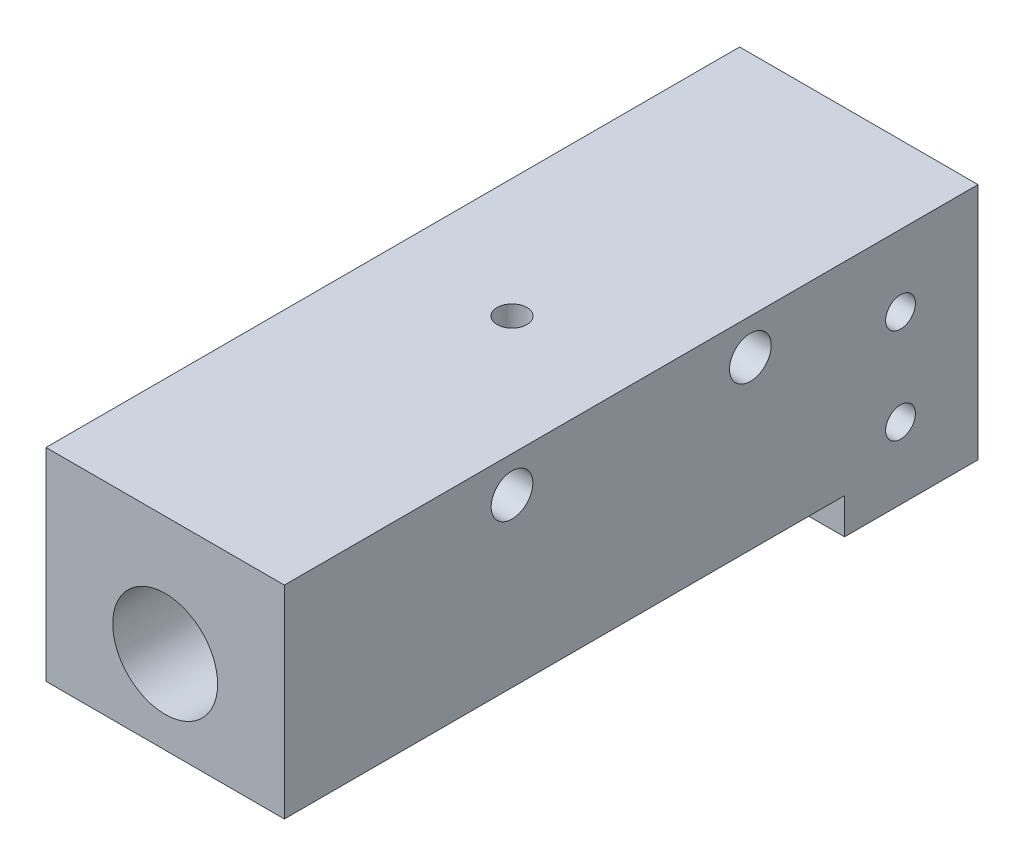
from build123d import *

# Parameters (mm, degrees)
SCHIZZO1_W                    = 20
SCHIZZO1_H                    = 20
ESTRUSIONE_ESTRUSIONE1_DEPTH  = 58.2
SCHIZZO2_R                    = 3
TAGLIO_ESTRUSIONE1_DEPTH      = 60.893572276
SCHIZZO3_R                    = 6
TAGLIO_ESTRUSIONE2_DEPTH      = 13
SCHIZZO4_R                    = 1.75
TAGLIO_ESTRUSIONE3_DEPTH      = 63.347734522
FORO_FILETTATO_G1_8_1_D       = 8.8
FORO_FILETTATO_G1_8_1_DEPTH   = 10
FORO_FILETTATO_G1_8_1_TIP     = 2.643786724
TAGLIO_ESTRUSIONE5_DEPTH      = 63.347734522
TAGLIO_ESTRUSIONE5_DEPTH_BACK = 63.347734522
FORO_FILETTATO_M3_1_D         = 2.5
FORO_FILETTATO_M3_1_DEPTH     = 5
FORO_FILETTATO_M3_1_TIP       = 0.751075774
FORO_FILETTATO_M3_2_D         = 2.5
FORO_FILETTATO_M3_2_DEPTH     = 6.5
FORO_FILETTATO_M3_2_TIP       = 0.751075774


with BuildPart() as part:
    # Schizzo1 → Estrusione-Estrusione1 (new body)
    with BuildSketch(Plane.XY):
        Rectangle(SCHIZZO1_W, SCHIZZO1_H)
    extrude(amount=-ESTRUSIONE_ESTRUSIONE1_DEPTH)

    # Schizzo2 → Taglio-Estrusione1 (cut, through all)
    with BuildSketch(Plane(origin=(0, 0, -58.2), x_dir=(-1, 0, 0), z_dir=(0, 0, -1))):
        Circle(SCHIZZO2_R)
    extrude(amount=-TAGLIO_ESTRUSIONE1_DEPTH, mode=Mode.SUBTRACT)

    # Schizzo3 → Taglio-Estrusione2 (cut)
    with BuildSketch(Plane(origin=(0, 0, -58.2), x_dir=(-1, 0, 0), z_dir=(0, 0, -1))):
        Circle(SCHIZZO3_R)
    extrude(amount=-TAGLIO_ESTRUSIONE2_DEPTH, mode=Mode.SUBTRACT)

    # Schizzo4 → Taglio-Estrusione3 (cut, through all)
    with BuildSketch(Plane(origin=(10, 0, 0), x_dir=(0, 0, -1), z_dir=(1, 0, 0))):
        with Locations((19.1, 7)):
            Circle(SCHIZZO4_R)
        with Locations((39.1, 7)):
            Circle(SCHIZZO4_R)
    extrude(amount=-TAGLIO_ESTRUSIONE3_DEPTH, mode=Mode.SUBTRACT)

    # Foro filettato G1/8-1
    with Locations(Plane.XY):
        with Locations((0, 0)):
            Hole(FORO_FILETTATO_G1_8_1_D / 2, depth=FORO_FILETTATO_G1_8_1_DEPTH)
            with Locations((0, 0, -(FORO_FILETTATO_G1_8_1_DEPTH + FORO_FILETTATO_G1_8_1_TIP / 2))):  # 118° drill point
                Cone(0, FORO_FILETTATO_G1_8_1_D / 2, FORO_FILETTATO_G1_8_1_TIP, mode=Mode.SUBTRACT)

    # Schizzo10 → Taglio-Estrusione5 (cut, two sides: drawn at the far end of the back side and taken through both)
    with BuildSketch(Plane(origin=(10, 0, 0), x_dir=(0, 0, -1), z_dir=(1, 0, 0)).offset(-TAGLIO_ESTRUSIONE5_DEPTH_BACK)):
        Polygon((-131.2640095, -7), (0, -7), (47, -7), (47, -10), (47, -141.2640095), (-110.942613081, -350.966397977), (-289.206622581, -216.702388477), align=None)
    extrude(amount=TAGLIO_ESTRUSIONE5_DEPTH + TAGLIO_ESTRUSIONE5_DEPTH_BACK, mode=Mode.SUBTRACT)

    # Foro filettato M3-1
    with Locations(Plane(origin=(0, 10, -29.1), x_dir=(1, 0, 0), z_dir=(0, 1, 0))):
        with Locations((0, 0)):
            Hole(FORO_FILETTATO_M3_1_D / 2, depth=FORO_FILETTATO_M3_1_DEPTH)
            with Locations((0, 0, -(FORO_FILETTATO_M3_1_DEPTH + FORO_FILETTATO_M3_1_TIP / 2))):  # 118° drill point
                Cone(0, FORO_FILETTATO_M3_1_D / 2, FORO_FILETTATO_M3_1_TIP, mode=Mode.SUBTRACT)

    # Foro filettato M3-2
    with Locations(Plane(origin=(10, 4, -51.7), x_dir=(0, 0, 1), z_dir=(1, 0, 0))):
        with Locations((0, 0), (0, 8)):
            Hole(FORO_FILETTATO_M3_2_D / 2, depth=FORO_FILETTATO_M3_2_DEPTH)
            with Locations((0, 0, -(FORO_FILETTATO_M3_2_DEPTH + FORO_FILETTATO_M3_2_TIP / 2))):  # 118° drill point
                Cone(0, FORO_FILETTATO_M3_2_D / 2, FORO_FILETTATO_M3_2_TIP, mode=Mode.SUBTRACT)


solid = part.part
